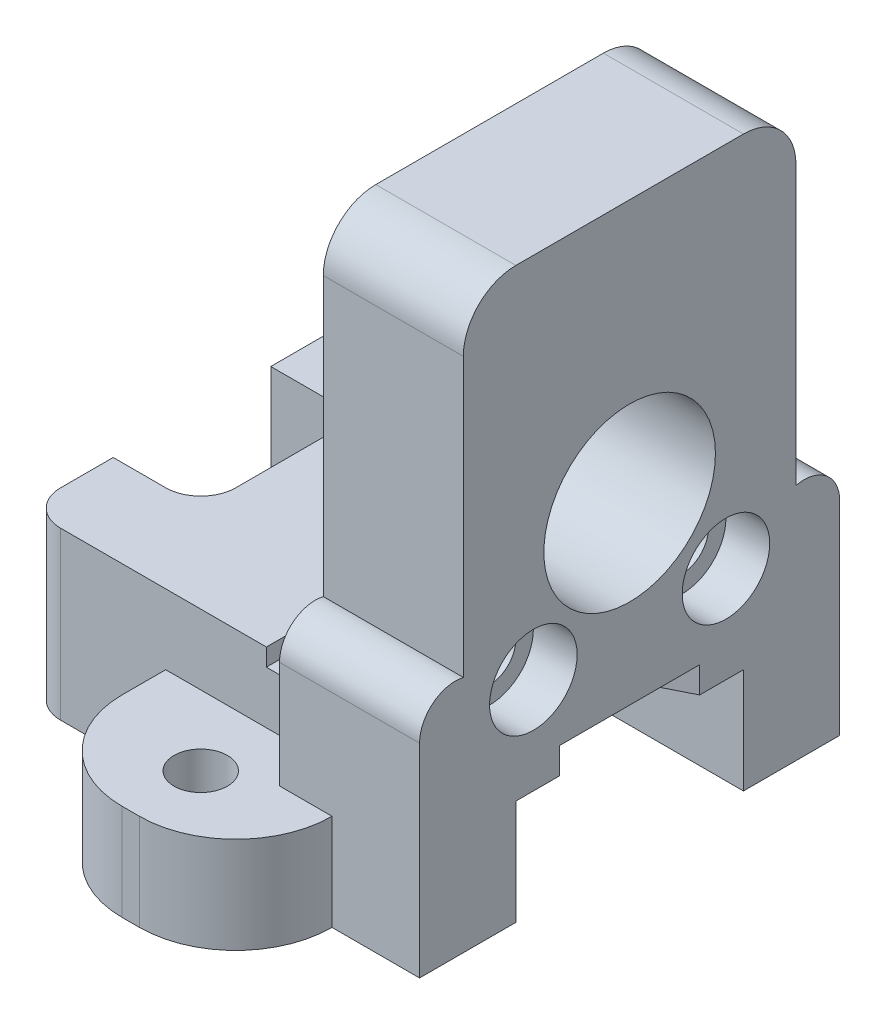
from build123d import *

# Parameters (mm, degrees)
SKETCH1_W           = 22
SKETCH1_H           = 13
BOSS_EXTRUDE1_DEPTH = 6
BOSS_EXTRUDE2_DEPTH = 3.5
BOSS_EXTRUDE3_DEPTH = 9.5
SKETCH4_R           = 1.525
SKETCH4_R_2         = 1.524
CUT_EXTRUDE1_DEPTH  = 36.933967218
SKETCH5_W           = 9
SKETCH5_H           = 5.5
CUT_EXTRUDE2_DEPTH  = 39.082148049
FILLET1_R           = 2
SKETCH6_W           = 12
SKETCH6_H           = 13.009000019
SKETCH6_W_2         = 15.838286437
CUT_EXTRUDE3_DEPTH  = 4
BOSS_EXTRUDE4_DEPTH = 23
CUT_EXTRUDE4_DEPTH  = 23
SKETCH9_R           = 4.9
CUT_EXTRUDE6_DEPTH  = 23
SKETCH10_R          = 1.5
CUT_EXTRUDE7_DEPTH  = 23
BOSS_EXTRUDE5_DEPTH = 3
FILLET2_R           = 2.5
FILLET3_R           = 2.5
SKETCH12_W          = 20
SKETCH12_H          = 3
CUT_EXTRUDE8_DEPTH  = 1.5
BOSS_EXTRUDE6_DEPTH = 8
SKETCH15_R          = 4.9
SKETCH15_R_2        = 1.5
CUT_EXTRUDE9_DEPTH  = 48.51052515
SKETCH16_W          = 29.561254557
SKETCH16_H          = 40.782628596
CUT_EXTRUDE10_DEPTH = 3
SKETCH17_W          = 8
SKETCH17_H          = 5.5
BOSS_EXTRUDE7_DEPTH = 9.5
CUT_EXTRUDE11_DEPTH = 1.5
SKETCH20_R          = 2.5
CUT_EXTRUDE12_DEPTH = 2.5
SKETCH19_W          = 3.25
SKETCH19_H          = 19
CUT_EXTRUDE13_DEPTH = 1
CHAMFER1_SIZE       = 1
FILLET4_R           = 3


with BuildPart() as part:
    # Sketch1 → Boss-Extrude1 (new body)
    with BuildSketch(Plane(origin=(0, 0, 0), x_dir=(1, 0, 0), z_dir=(0, 1, 0))):
        with BuildLine():
            Line((-1, -3), (23, -3))
            Line((23, -3), (25, -3))
            Line((25, -3), (25, -1))
            Line((25, -1), (25, 14))
            Line((25, 14), (25, 16))
            Line((25, 16), (23, 16))
            Line((23, 16), (-1, 16))
            ThreePointArc((-1, 16), (-2.414213562, 15.414213562), (-3, 14))
            Line((-3, 14), (-3, -1))
            ThreePointArc((-3, -1), (-2.414213562, -2.414213562), (-1, -3))
        make_face()
        with Locations((11, 6.5)):
            Rectangle(SKETCH1_W, SKETCH1_H, mode=Mode.SUBTRACT)
    extrude(amount=BOSS_EXTRUDE1_DEPTH)

    # Sketch2 → Boss-Extrude2 (add)
    with BuildSketch(Plane(origin=(0, 6, 0), x_dir=(1, 0, 0), z_dir=(0, 1, 0))):
        with BuildLine():
            Line((25, 14), (25, -1))
            Line((25, -1), (25, -3))
            Line((25, -3), (23, -3))
            Line((23, -3), (-1, -3))
            ThreePointArc((-1, -3), (-2.414213562, -2.414213562), (-3, -1))
            Line((-3, -1), (-3, 14))
            ThreePointArc((-3, 14), (-2.414213562, 15.414213562), (-1, 16))
            Line((-1, 16), (23, 16))
            Line((23, 16), (25, 16))
            Line((25, 16), (25, 14))
        make_face()
    extrude(amount=BOSS_EXTRUDE2_DEPTH)

    # Sketch3 → Boss-Extrude3 (add)
    with BuildSketch(Plane.XZ):
        with BuildLine():
            Line((5, 3), (17, 3))
            Line((17, 3), (17, 5.5))
            ThreePointArc((17, 5.5), (15.389087297, 9.389087297), (11.5, 11))
            Line((11.5, 11), (10.5, 11))
            ThreePointArc((10.5, 11), (6.610912703, 9.389087297), (5, 5.5))
            Line((5, 5.5), (5, 3))
        make_face()
        with BuildLine():
            Line((17, -16), (5, -16))
            Line((5, -16), (5, -18.5))
            ThreePointArc((5, -18.5), (6.610912703, -22.389087297), (10.5, -24))
            Line((10.5, -24), (11.5, -24))
            ThreePointArc((11.5, -24), (15.389087297, -22.389087297), (17, -18.5))
            Line((17, -18.5), (17, -16))
        make_face()
    extrude(amount=-BOSS_EXTRUDE3_DEPTH)

    # Sketch4 → Cut-Extrude1 (cut, through all)
    with BuildSketch(Plane(origin=(0, 0, 0), x_dir=(-1, 0, 0), z_dir=(0, -1, 0))):
        with Locations(Location((-11, 20, 0), (0, 0, 90))):
            Circle(SKETCH4_R)
        with Locations(Location((-11, -7, 0), (0, 0, 90))):
            Circle(SKETCH4_R_2)
    extrude(amount=-CUT_EXTRUDE1_DEPTH, mode=Mode.SUBTRACT)

    # Sketch5 → Cut-Extrude2 (cut, through all)
    with BuildSketch(Plane(origin=(25, 0, 0), x_dir=(0, 0, -1), z_dir=(1, 0, 0))):
        with Locations((6.5, 2.75)):
            Rectangle(SKETCH5_W, SKETCH5_H)
    extrude(amount=-CUT_EXTRUDE2_DEPTH, mode=Mode.SUBTRACT)

    # Fillet1
    fillet1_edges = [part.edges().sort_by_distance(p)[0] for p in [
        (-1.5, 5.5, -11),
        (-1.5, 5.5, -2),
        (23.5, 5.5, -11),
        (23.5, 5.5, -2),
    ]]
    fillet(fillet1_edges, radius=FILLET1_R)

    # Sketch6 → Cut-Extrude3 (cut)
    with BuildSketch(Plane(origin=(0, 9.5, 0), x_dir=(1, 0, 0), z_dir=(0, 1, 0))):
        with Locations((11, 22.504500009)):
            Rectangle(SKETCH6_W, SKETCH6_H)
        with Locations((11.149066226, -9.50450001)):
            Rectangle(SKETCH6_W_2, SKETCH6_H)
    extrude(amount=-CUT_EXTRUDE3_DEPTH, mode=Mode.SUBTRACT)

    # Sketch7 → Boss-Extrude4 (add)
    with BuildSketch(Plane(origin=(0, 9.5, 0), x_dir=(1, 0, 0), z_dir=(0, 1, 0))):
        Polygon((23, 16), (22, 16), (22, -3), (23, -3), (25, -3), (25, -1), (25, 14), (25, 16), align=None)
    extrude(amount=BOSS_EXTRUDE4_DEPTH)

    # Sketch8 → Cut-Extrude4 (cut)
    with BuildSketch(Plane(origin=(0, 9.5, 0), x_dir=(1, 0, 0), z_dir=(0, 1, 0))):
        with BuildLine():
            Line((-3, 2), (0, 2))
            ThreePointArc((0, 2), (1.414213562, 2.585786438), (2, 4))
            Line((2, 4), (2, 9))
            ThreePointArc((2, 9), (1.414213562, 10.414213562), (0, 11))
            Line((0, 11), (-3, 11))
            Line((-3, 11), (-3, 2))
        make_face()
    extrude(amount=-CUT_EXTRUDE4_DEPTH, mode=Mode.SUBTRACT)

    # Sketch9 → Cut-Extrude6 (cut)
    with BuildSketch(Plane.ZY.offset(-22)):
        with Locations((-6.5, 17.5)):
            Circle(SKETCH9_R)
    extrude(amount=-CUT_EXTRUDE6_DEPTH, mode=Mode.SUBTRACT)

    # Sketch10 → Cut-Extrude7 (cut)
    with BuildSketch(Plane.ZY.offset(-22)):
        with Locations((-12, 11.5)):
            Circle(SKETCH10_R)
        with Locations((-1, 11.5)):
            Circle(SKETCH10_R)
    extrude(amount=-CUT_EXTRUDE7_DEPTH, mode=Mode.SUBTRACT)

    # Sketch11 → Boss-Extrude5 (add)
    with BuildSketch(Plane(origin=(25, 0, 0), x_dir=(0, 0, -1), z_dir=(1, 0, 0))):
        with BuildLine():
            Line((-3, 0), (-5.5, 0))
            Line((-5.5, 0), (-5.5, 11.617902622))
            ThreePointArc((-5.5, 11.617902622), (-4.914213562, 13.032116185), (-3.5, 13.617902622))
            Line((-3.5, 13.617902622), (-3, 13.617902622))
            Line((-3, 13.617902622), (-3, 0))
        make_face()
        with BuildLine():
            Line((16, 0), (18.5, 0))
            Line((18.5, 0), (18.5, 11.617902622))
            ThreePointArc((18.5, 11.617902622), (17.914213562, 13.032116185), (16.5, 13.617902622))
            Line((16.5, 13.617902622), (16, 13.617902622))
            Line((16, 13.617902622), (16, 0))
        make_face()
    extrude(amount=-BOSS_EXTRUDE5_DEPTH)

    # Fillet2
    fillet2_edges = [part.edges().sort_by_distance(p)[0] for p in [
        (22, 4.75, 3),
    ]]
    fillet(fillet2_edges, radius=FILLET2_R - 0.0001)  # a hair under: the kernel refuses the full size

    # Fillet3
    fillet3_edges = [part.edges().sort_by_distance(p)[0] for p in [
        (22, 4.75, -16),
    ]]
    fillet(fillet3_edges, radius=FILLET3_R - 0.0001)  # a hair under: the kernel refuses the full size

    # Sketch12 → Cut-Extrude8 (cut)
    with BuildSketch(Plane.XZ.offset(-6)):
        with Locations((12, -6.5)):
            Rectangle(SKETCH12_W, SKETCH12_H)
    extrude(amount=-CUT_EXTRUDE8_DEPTH, mode=Mode.SUBTRACT)

    # Sketch14 → Boss-Extrude6 (add)
    with BuildSketch(Plane.ZY.offset(-22)):
        with BuildLine():
            Line((-16, 32.5), (3, 32.5))
            Line((3, 32.5), (3, 13.617902622))
            ThreePointArc((3, 13.617902622), (4.730624847, 13.218683682), (5.5, 11.617902622))
            Line((5.5, 11.617902622), (5.5, 9.5))
            Line((5.5, 9.5), (3, 9.5))
            Line((3, 9.5), (-16, 9.5))
            Line((-16, 9.5), (-18.5, 9.5))
            Line((-18.5, 9.5), (-18.5, 11.617902622))
            ThreePointArc((-18.5, 11.617902622), (-17.730624847, 13.218683682), (-16, 13.617902622))
            Line((-16, 13.617902622), (-16, 32.5))
        make_face()
    extrude(amount=BOSS_EXTRUDE6_DEPTH)

    # Sketch15 → Cut-Extrude9 (cut, through all)
    with BuildSketch(Plane(origin=(22, 0, 0), x_dir=(0, 0, -1), z_dir=(1, 0, 0))):
        with Locations(Location((6.5, 17.5, 0), (0, 0, 180))):
            Circle(SKETCH15_R)
        with Locations(Location((1, 11.5, 0), (0, 0, 180))):
            Circle(SKETCH15_R_2)
        with Locations(Location((12, 11.5, 0), (0, 0, 180))):
            Circle(SKETCH15_R_2)
    extrude(amount=-CUT_EXTRUDE9_DEPTH, mode=Mode.SUBTRACT)

    # Sketch16 → Cut-Extrude10 (cut)
    with BuildSketch(Plane(origin=(25, 0, 0), x_dir=(0, 0, -1), z_dir=(1, 0, 0))):
        with Locations((4.352462689, 15.924842514)):
            Rectangle(SKETCH16_W, SKETCH16_H)
    extrude(amount=-CUT_EXTRUDE10_DEPTH, mode=Mode.SUBTRACT)

    # Sketch17 → Boss-Extrude7 (add)
    with BuildSketch(Plane.XZ):
        with Locations((18, -15.75)):
            Rectangle(SKETCH17_W, SKETCH17_H)
        with Locations((18, 2.75)):
            Rectangle(SKETCH17_W, SKETCH17_H)
    extrude(amount=-BOSS_EXTRUDE7_DEPTH)

    # Sketch18 → Cut-Extrude11 (cut)
    with BuildSketch(Plane(origin=(0, 6, 0), x_dir=(-1, 0, 0), z_dir=(0, -1, 0))):
        Polygon((-22, 2.5), (-17, 5), (-17, 8), (-22, 10.5), align=None)
    extrude(amount=-CUT_EXTRUDE11_DEPTH, mode=Mode.SUBTRACT)

    # Sketch20 → Cut-Extrude12 (cut)
    with BuildSketch(Plane(origin=(22, 0, 0), x_dir=(0, 0, -1), z_dir=(1, 0, 0))):
        with Locations((1, 11.5)):
            Circle(SKETCH20_R)
        with Locations((12, 11.5)):
            Circle(SKETCH20_R)
    extrude(amount=-CUT_EXTRUDE12_DEPTH, mode=Mode.SUBTRACT)

    # Sketch19 → Cut-Extrude13 (cut)
    with BuildSketch(Plane(origin=(0, 9.5, 0), x_dir=(1, 0, 0), z_dir=(0, 1, 0))):
        with Locations((12.375, 6.5)):
            Rectangle(SKETCH19_W, SKETCH19_H)
    extrude(amount=-CUT_EXTRUDE13_DEPTH, mode=Mode.SUBTRACT)

    # Chamfer1
    chamfer1_edges = [part.edges().sort_by_distance(p)[0] for p in [
        (14, 17.5, -11.4),
    ]]
    chamfer(chamfer1_edges, length=CHAMFER1_SIZE)

    # Fillet4
    fillet4_edges = [part.edges().sort_by_distance(p)[0] for p in [
        (18, 32.5, 3),
        (18, 32.5, -16),
    ]]
    fillet(fillet4_edges, radius=FILLET4_R)


solid = part.part
